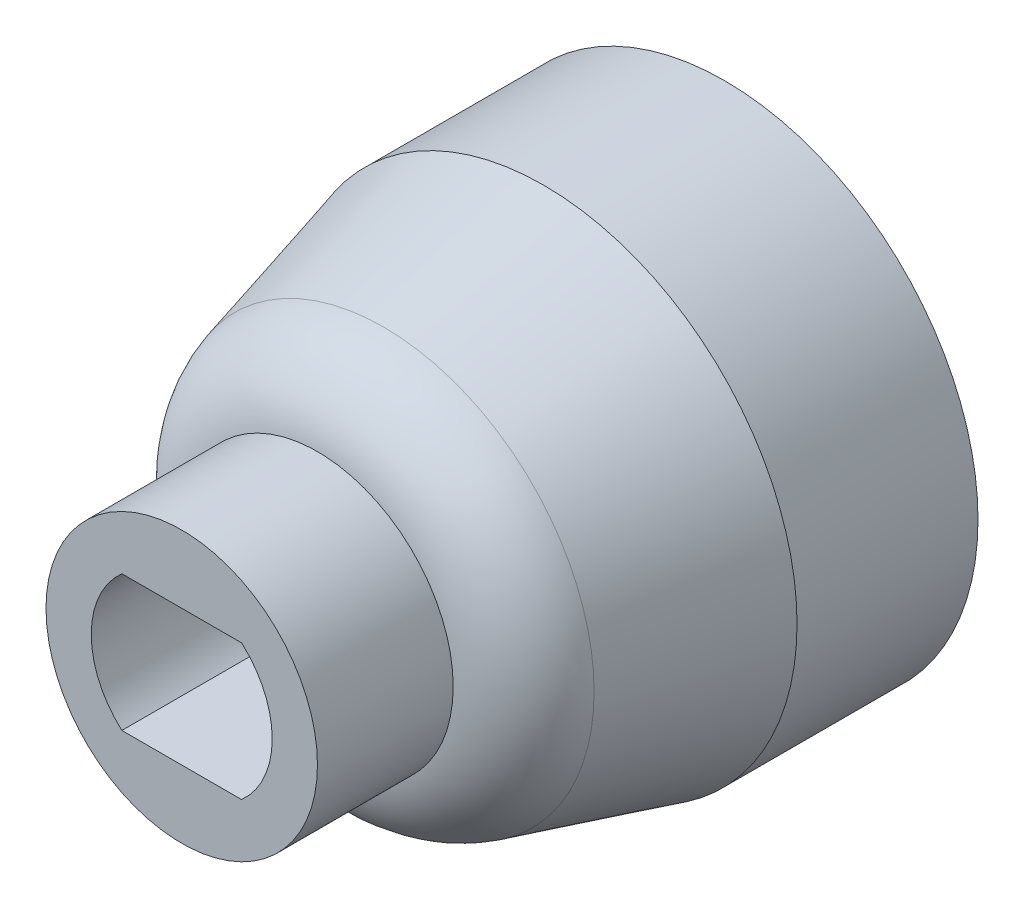
from build123d import *

# Parameters (mm, degrees)
SKETCH1_R           = 5.6
BOSS_EXTRUDE1_DEPTH = 9
SKETCH2_R           = 3
BOSS_EXTRUDE2_DEPTH = 3
CHAMFER1_SIZE       = 5
CHAMFER1_SIZE2      = 1.339745962


with BuildPart() as part:
    # Sketch1 → Boss-Extrude1 (new body)
    with BuildSketch(Plane.XY):
        Circle(SKETCH1_R)
    extrude(amount=BOSS_EXTRUDE1_DEPTH)

    # Sketch2 → Boss-Extrude2 (add)
    with BuildSketch(Plane.XY.offset(9)):
        Circle(SKETCH2_R)
        with BuildLine():
            Line((-1.322875656, -1.5), (1.322875656, -1.5))
            ThreePointArc((1.322875656, -1.5), (2, 0), (1.322875656, 1.5))
            Line((1.322875656, 1.5), (-1.322875656, 1.5))
            ThreePointArc((-1.322875656, 1.5), (-2, 0), (-1.322875656, -1.5))
        make_face(mode=Mode.SUBTRACT)
    extrude(amount=BOSS_EXTRUDE2_DEPTH)

    # Chamfer1
    chamfer1_edges = [part.edges().sort_by_distance(p)[0] for p in [
        (-5.6, 0, 9),
    ]]
    chamfer1_side = [part.faces().sort_by_distance(p)[0] for p in [
        (-5.6, 0, 4.5),
    ]]
    chamfer(chamfer1_edges, length=CHAMFER1_SIZE, length2=CHAMFER1_SIZE2, reference=chamfer1_side[0])

    # Fillet1: read off the stored shape, not the designer's step
    # Fillet1 outline → Fillet1 (revolve, cut)
    with BuildSketch(Plane.XZ):
        with BuildLine():
            Line((4.652186603, 7.537287752), (4.652186603, 9))
            Line((4.652186603, 9), (3, 9))
            ThreePointArc((3, 9), (4.04607373, 8.517119759), (4.652186603, 7.537287752))
        make_face()
    revolve(axis=Axis((0, 0, 0), (0, 0, 1)), mode=Mode.SUBTRACT)


solid = part.part
